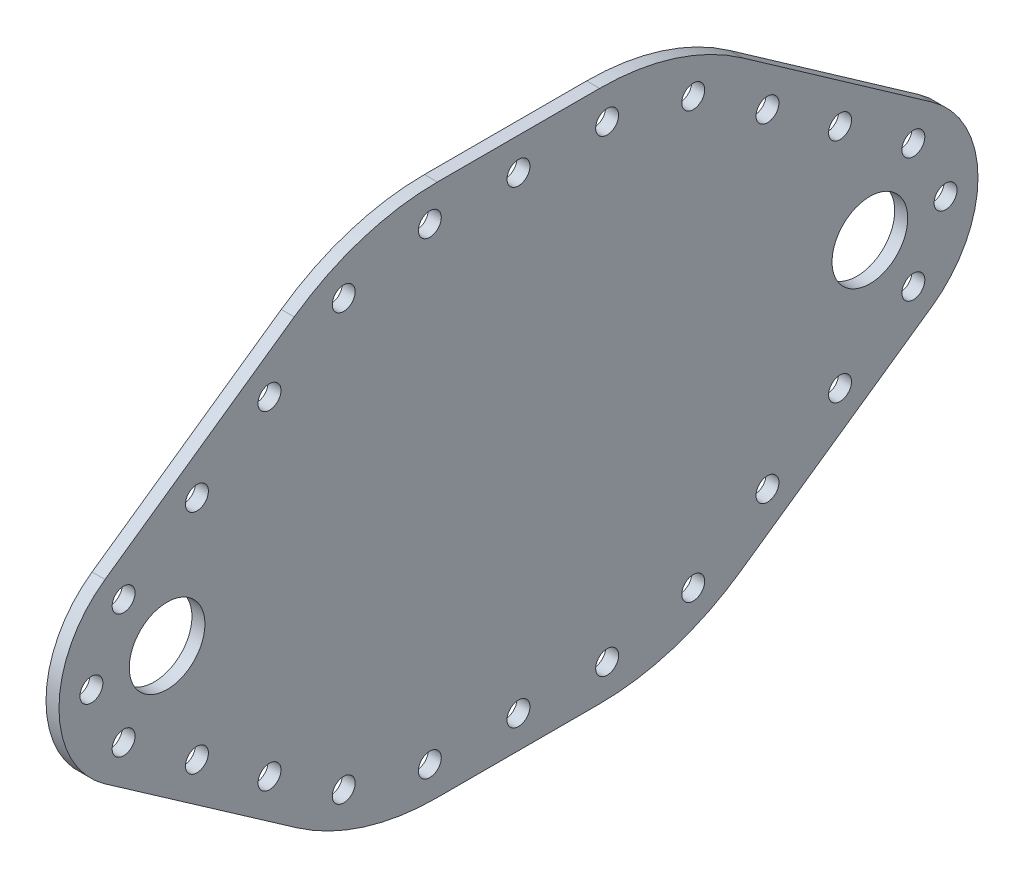
from build123d import *

# Parameters (mm, degrees)
BOSS_EXTRUDE1_DEPTH    = 3.048
CUT_EXTRUDE3_START     = -3.048
CUT_EXTRUDE3_OUTLINE_R = 2.69253261
CUT_EXTRUDE3_DEPTH     = 3.048
SKETCH6_R              = 8.89
CUT_EXTRUDE5_DEPTH     = 12.7


# Read off the part's stored shape, not the designer's step: Cut-Extrude3
with BuildPart() as part:
    # Sketch1 → Boss-Extrude1 (new body)
    with BuildSketch(Plane(origin=(0, 0, 0), x_dir=(0, 0, -1), z_dir=(1, 0, 0))):
        with BuildLine():
            Line((19.05, 62.611), (-19.05, 62.611))
            ThreePointArc((-19.05, 62.611), (-36.688219036, 59.891543079), (-52.688239169, 51.985749479))
            Line((-52.688239169, 51.985749479), (-97.140382944, 20.791361801))
            ThreePointArc((-97.140382944, 20.791361801), (-107.949982522, -0.029797308), (-97.091561196, -20.82553716))
            Line((-97.091561196, -20.82553716), (-52.170359894, -52.19204611))
            ThreePointArc((-52.170359894, -52.19204611), (-36.41024798, -59.944824567), (-19.05, -62.611))
            Line((-19.05, -62.611), (19.05, -62.611))
            ThreePointArc((19.05, -62.611), (36.41024798, -59.944824567), (52.170359894, -52.19204611))
            Line((52.170359894, -52.19204611), (97.091561196, -20.82553716))
            ThreePointArc((97.091561196, -20.82553716), (107.949982522, -0.029797308), (97.140382944, 20.791361801))
            Line((97.140382944, 20.791361801), (52.688239169, 51.985749479))
            ThreePointArc((52.688239169, 51.985749479), (36.688219036, 59.891543079), (19.05, 62.611))
        make_face()
    extrude(amount=BOSS_EXTRUDE1_DEPTH)

    # Cut-Extrude3 outline → Cut-Extrude3 (cut)
    with BuildSketch(Plane(origin=(3.048, 0, 0), x_dir=(0, 0, -1), z_dir=(1, 0, 0)).offset(CUT_EXTRUDE3_START)):
        with Locations((0, 54.991)):
            Circle(CUT_EXTRUDE3_OUTLINE_R)
        with Locations((20.828, 54.959960993)):
            Circle(CUT_EXTRUDE3_OUTLINE_R)
        with Locations((41.055062572, 49.992917233)):
            Circle(CUT_EXTRUDE3_OUTLINE_R)
        with Locations((58.492960359, 38.603215535)):
            Circle(CUT_EXTRUDE3_OUTLINE_R)
        with Locations((75.541877036, 26.639101521)):
            Circle(CUT_EXTRUDE3_OUTLINE_R)
        with Locations((92.763268061, 14.553953261)):
            Circle(CUT_EXTRUDE3_OUTLINE_R)
        with Locations((100.329987765, -0.020858116)):
            Circle(CUT_EXTRUDE3_OUTLINE_R)
        with Locations((92.763268061, -14.553953261)):
            Circle(CUT_EXTRUDE3_OUTLINE_R)
        with Locations((-20.828, 54.959960993)):
            Circle(CUT_EXTRUDE3_OUTLINE_R)
        with Locations((-41.055062572, 49.992917233)):
            Circle(CUT_EXTRUDE3_OUTLINE_R)
        with Locations((-58.492960359, 38.603215535)):
            Circle(CUT_EXTRUDE3_OUTLINE_R)
        with Locations((-75.541877036, 26.639101521)):
            Circle(CUT_EXTRUDE3_OUTLINE_R)
        with Locations((-92.763268061, 14.553953261)):
            Circle(CUT_EXTRUDE3_OUTLINE_R)
        with Locations((-100.329987765, -0.020858116)):
            Circle(CUT_EXTRUDE3_OUTLINE_R)
        with Locations((-92.763268061, -14.553953261)):
            Circle(CUT_EXTRUDE3_OUTLINE_R)
        with Locations((-75.541877036, -26.639101521)):
            Circle(CUT_EXTRUDE3_OUTLINE_R)
        with Locations((-58.492960359, -38.603215535)):
            Circle(CUT_EXTRUDE3_OUTLINE_R)
        with Locations((-41.055062572, -49.992917233)):
            Circle(CUT_EXTRUDE3_OUTLINE_R)
        with Locations((-20.828, -54.959960993)):
            Circle(CUT_EXTRUDE3_OUTLINE_R)
        with Locations((0, -54.991)):
            Circle(CUT_EXTRUDE3_OUTLINE_R)
        with Locations((20.828, -54.959960993)):
            Circle(CUT_EXTRUDE3_OUTLINE_R)
        with Locations((41.055062572, -49.992917233)):
            Circle(CUT_EXTRUDE3_OUTLINE_R)
        with Locations((58.492960359, -38.603215535)):
            Circle(CUT_EXTRUDE3_OUTLINE_R)
        with Locations((75.541877036, -26.639101521)):
            Circle(CUT_EXTRUDE3_OUTLINE_R)
    extrude(amount=CUT_EXTRUDE3_DEPTH, mode=Mode.SUBTRACT)

    # Sketch6 → Cut-Extrude5 (cut)
    with BuildSketch(Plane(origin=(3.048, 0, 0), x_dir=(0, 0, -1), z_dir=(1, 0, 0))):
        with Locations((-82.55, 0)):
            Circle(SKETCH6_R)
        with Locations((82.55, 0)):
            Circle(SKETCH6_R)
    extrude(amount=-CUT_EXTRUDE5_DEPTH, mode=Mode.SUBTRACT)


solid = part.part
